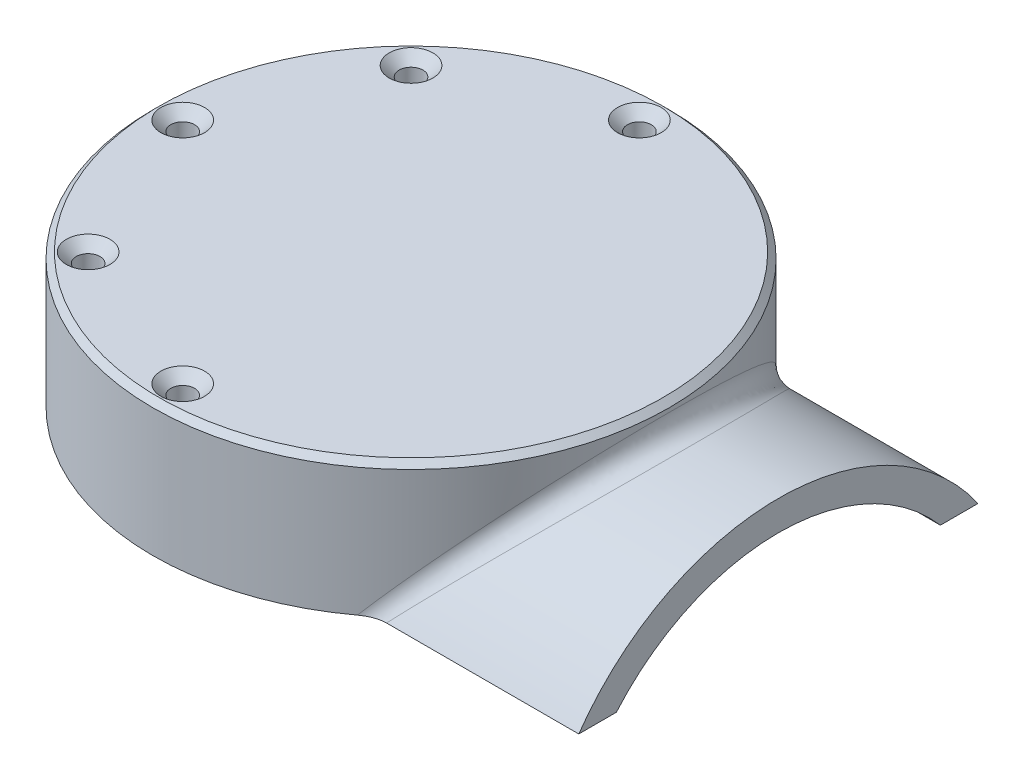
from build123d import *

# Parameters (mm, degrees)
SKETCH_1_W                  = 26
SKETCH_1_H                  = 27.5
SKETCH_2_W                  = 37
SKETCH_2_H                  = 24.5
CHAMFER_1_SIZE              = 0.6
SKETCH_5_W                  = 37
SKETCH_5_H                  = 21.5
CUT_EXTRUDE_1_DEPTH         = 14
CUT_EXTRUDE_1_DEPTH_BACK    = 53.926836412
HOLE_WIZARD_M21_D           = 2.4
HOLE_WIZARD_M21_CSINK_D     = 4.4
HOLE_WIZARD_M21_CSINK_ANGLE = 90
PATTERN_CIRCULAR_1_COUNT    = 3
PATTERN_CIRCULAR_1_ANGLE    = 90
F_1_THE_OTHER_WAY_COUNT     = 3
F_1_THE_OTHER_WAY_ANGLE     = 90
FILLET_1_R                  = 2
FILLET_2_R                  = 2


with BuildPart() as part:
    # Эскиз1 → Повернуть1 (revolve)
    with BuildSketch(Plane.XY):
        with Locations((-13, 13.75)):
            Rectangle(SKETCH_1_W, SKETCH_1_H)
    revolve(axis=Axis((0, 0, 0), (0, 1, 0)))

    # Эскиз2 → Повернуть2 (revolve)
    with BuildSketch(Plane.XY):
        with Locations((18.5, 12.25)):
            Rectangle(SKETCH_2_W, SKETCH_2_H)
    revolve(axis=Axis((0, 0, 0), (1, 0, 0)))

    # Фаска1
    chamfer_1_edges = [part.edges().sort_by_distance(p)[0] for p in [
        (26, 27.5, 0),
    ]]
    chamfer(chamfer_1_edges, length=CHAMFER_1_SIZE)

    # Эскиз4 → Вырез-Повернуть1 (revolve, cut)
    with BuildSketch(Plane.XY):
        Polygon((0, 0), (-25, 0), (-25, 20), (-21, 20), (-21, 24.5), (0, 24.5), align=None)
    revolve(axis=Axis((0, 0, 0), (0, 1, 0)), mode=Mode.SUBTRACT)

    # Эскиз5 → Вырез-Повернуть2 (revolve, cut)
    with BuildSketch(Plane.XY):
        with Locations((18.5, 10.75)):
            Rectangle(SKETCH_5_W, SKETCH_5_H)
    revolve(axis=Axis((0, 0, 0), (1, 0, 0)), mode=Mode.SUBTRACT)

    # Эскиз6 → Вырез-Вытянуть1 (cut, two sides: drawn at the far end of the back side and taken through both)
    with BuildSketch(Plane(origin=(0, 0, 0), x_dir=(1, 0, 0), z_dir=(0, 1, 0)).offset(-CUT_EXTRUDE_1_DEPTH_BACK)):
        with BuildLine():
            Line((8.703447593, 24.5), (37, 24.5))
            Line((37, 24.5), (37, -24.5))
            Line((37, -24.5), (8.703447593, -24.5))
            ThreePointArc((8.703447593, -24.5), (-26, 0), (8.703447593, 24.5))
        make_face()
    extrude(amount=CUT_EXTRUDE_1_DEPTH + CUT_EXTRUDE_1_DEPTH_BACK, mode=Mode.SUBTRACT)

    # Зенковка для винта с потайной головкой M21 (through all)
    with Locations(Plane(origin=(0, 27.5, 0), x_dir=(1, 0, 0), z_dir=(0, 1, 0))):
        with Locations((-23, 0)):
            hole_wizard_m21 = CounterSinkHole(HOLE_WIZARD_M21_D / 2, HOLE_WIZARD_M21_CSINK_D / 2, counter_sink_angle=HOLE_WIZARD_M21_CSINK_ANGLE)

    # Круговой массив1: Зенковка для винта с потайной головкой M21 ×3 about axis
    pattern_circular_1_axis = Axis((0, 27.5, 0), (0, 1, 0))
    for i in range(1, PATTERN_CIRCULAR_1_COUNT):
        add(hole_wizard_m21.rotate(pattern_circular_1_axis, i * PATTERN_CIRCULAR_1_ANGLE / (PATTERN_CIRCULAR_1_COUNT - 1)), mode=Mode.SUBTRACT)

    # 1 the other way: Зенковка для винта с потайной головкой M21 ×3 about axis
    f_1_the_other_way_axis = Axis((0, 27.5, 0), (0, -1, 0))
    for i in range(1, F_1_THE_OTHER_WAY_COUNT):
        add(hole_wizard_m21.rotate(f_1_the_other_way_axis, i * F_1_THE_OTHER_WAY_ANGLE / (F_1_THE_OTHER_WAY_COUNT - 1)), mode=Mode.SUBTRACT)

    # Скругление1
    fillet_1_edges = [part.edges().sort_by_distance(p)[0] for p in [
        (21, 24.5, 0),
    ]]
    fillet(fillet_1_edges, radius=FILLET_1_R)

    # Скругление2
    fillet_2_edges = [part.edges().sort_by_distance(p)[0] for p in [
        (26, 24.5, 0),
    ]]
    fillet(fillet_2_edges, radius=FILLET_2_R)


solid = part.part
